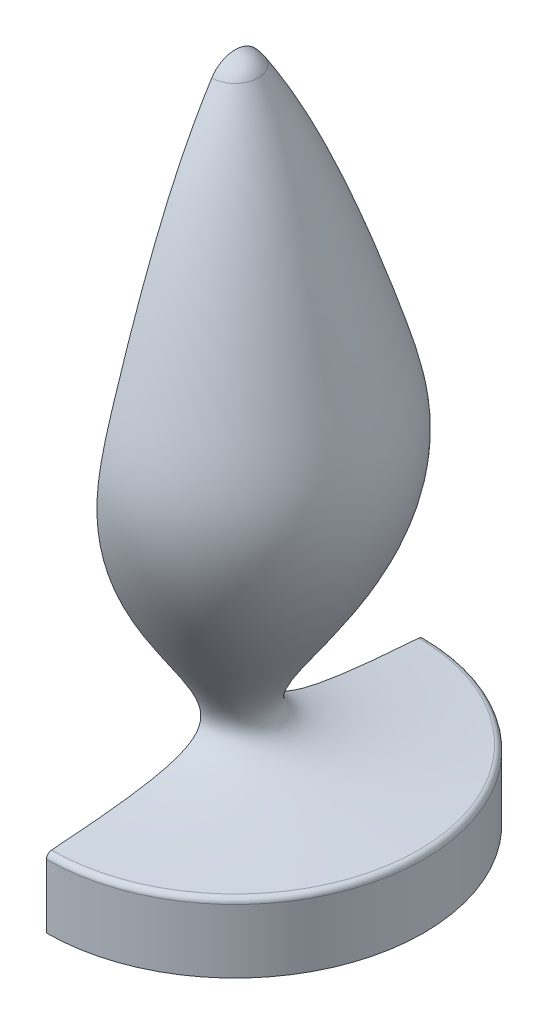
from build123d import *

# Parameters (mm, degrees)
FILLET5_R               = 0.508
CUT_EXTRUDE4_DEPTH      = 25.4
CUT_EXTRUDE4_DEPTH_BACK = 25.4
SKETCH8_W               = 27.315642458
SKETCH8_H               = 195.703997282


with BuildPart() as part:
    # Sketch1 → Revolve1 (revolve)
    with BuildSketch(Plane.XY):
        with BuildLine():
            Line((0, -61.837584602), (0, 0))
            ThreePointArc((0, 0), (1.223734169, -0.314224925), (2.144690561, -1.179153793))
            add(Edge.make_bspline(
                [(2.144690561, -1.179153793), (4.702836967, -5.210786776), (8.053361218, -12.021234711), (14.721106887, -34.29046723), (1.650247313, -51.777325014), (1.075662695, -54.375446138), (17.399, -55.487584602)],
                knots=[0.105965392, 0.105965392, 0.105965392, 0.105965392, 0.450909827, 0.511581648, 0.712683597, 1, 1, 1, 1], degree=3))
            Line((17.399, -55.487584602), (17.399, -61.837584602))
            Line((17.399, -61.837584602), (0, -61.837584602))
        make_face()
    revolve(axis=Axis((0, -61.837584602, 0), (0, 1, 0)))

    # Fillet5
    fillet5_edges = [part.edges().sort_by_distance(p)[0] for p in [
        (-17.399, -55.487584602, 0),
    ]]
    fillet(fillet5_edges, radius=FILLET5_R)

    # Sketch8 → Cut-Extrude4 (cut, two sides: drawn at the far end of the back side and taken through both)
    with BuildSketch(Plane.XY.offset(-CUT_EXTRUDE4_DEPTH_BACK)):
        with Locations((-13.657821229, 0)):
            Rectangle(SKETCH8_W, SKETCH8_H)
    extrude(amount=CUT_EXTRUDE4_DEPTH + CUT_EXTRUDE4_DEPTH_BACK, mode=Mode.SUBTRACT)


solid = part.part
